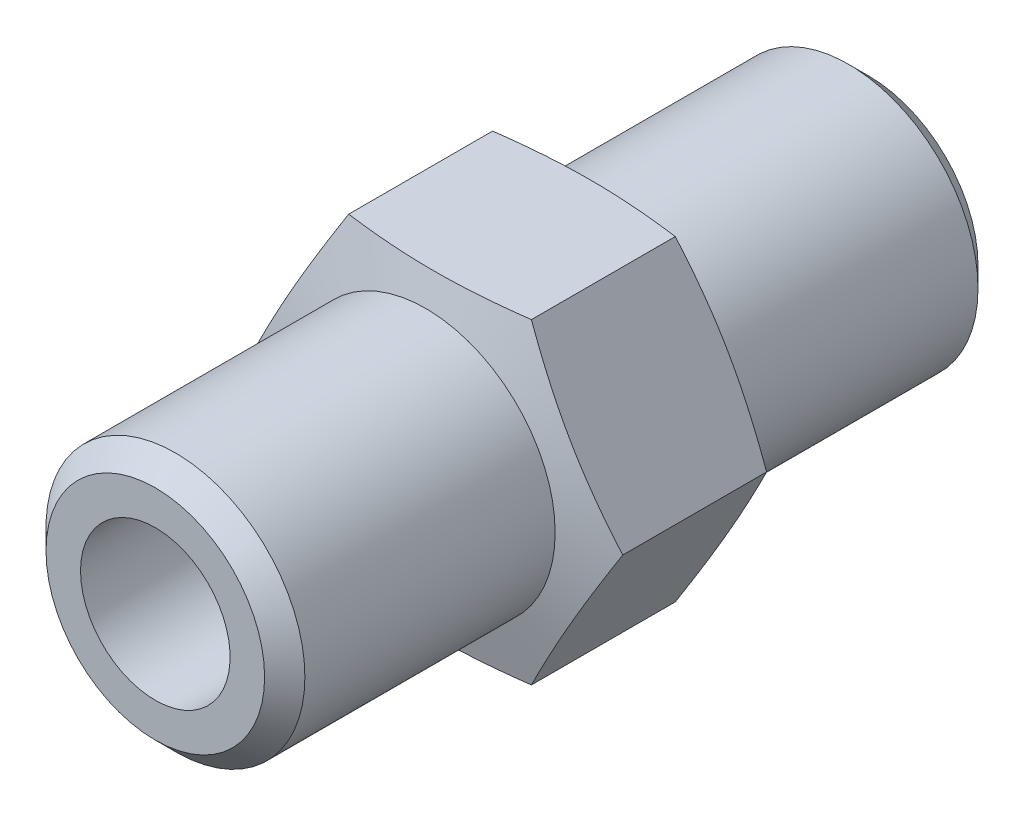
from build123d import *

# Parameters (mm, degrees)
BOSS_EXTRUDE1_DEPTH = 3
SKETCH2_R           = 4.5
BOSS_EXTRUDE2_DEPTH = 9.4
SKETCH3_R           = 2.6
CUT_EXTRUDE1_DEPTH  = 15.978095117
CHAMFER2_SIZE       = 0.7


with BuildPart() as part:
    # Sketch1 → Boss-Extrude1 (new body)
    with BuildSketch(Plane.XY):
        Polygon((6.350852961, 0), (3.175426481, 5.5), (-3.175426481, 5.5), (-6.350852961, 0), (-3.175426481, -5.5), (3.175426481, -5.5), align=None)
    boss_extrude1 = extrude(amount=BOSS_EXTRUDE1_DEPTH)

    # Sketch2 → Boss-Extrude2 (add)
    with BuildSketch(Plane.XY.offset(3)):
        Circle(SKETCH2_R)
    boss_extrude2 = extrude(amount=BOSS_EXTRUDE2_DEPTH)

    # Sketch3 → Cut-Extrude1 (cut, through all)
    with BuildSketch(Plane(origin=(0, 0, 0), x_dir=(-1, 0, 0), z_dir=(0, 0, -1))):
        Circle(SKETCH3_R)
    cut_extrude1 = extrude(amount=-CUT_EXTRUDE1_DEPTH, mode=Mode.SUBTRACT)

    # Sketch5 → Cut-Revolve2 (revolve, cut)
    with BuildSketch(Plane(origin=(0, 0, 0), x_dir=(1, 0, 0), z_dir=(0, 1, 0))):
        Polygon((-4.5, -3), (-6.350852961, -3), (-6.350852961, -2.5), align=None)
    cut_revolve2 = revolve(axis=Axis((0, 0, 12.4), (0, 0, -1)), mode=Mode.SUBTRACT)

    # Mirror3: Boss-Extrude1, Boss-Extrude2, Cut-Extrude1, Cut-Revolve2 across plane
    add(boss_extrude1.mirror(Plane.XY))
    add(boss_extrude2.mirror(Plane.XY))
    add(cut_extrude1.mirror(Plane.XY), mode=Mode.SUBTRACT)
    add(cut_revolve2.mirror(Plane.XY), mode=Mode.SUBTRACT)

    # Chamfer2
    chamfer2_edges = [part.edges().sort_by_distance(p)[0] for p in [
        (-4.5, 0, -12.4),
        (-4.5, 0, 12.4),
    ]]
    chamfer(chamfer2_edges, length=CHAMFER2_SIZE)


solid = part.part
